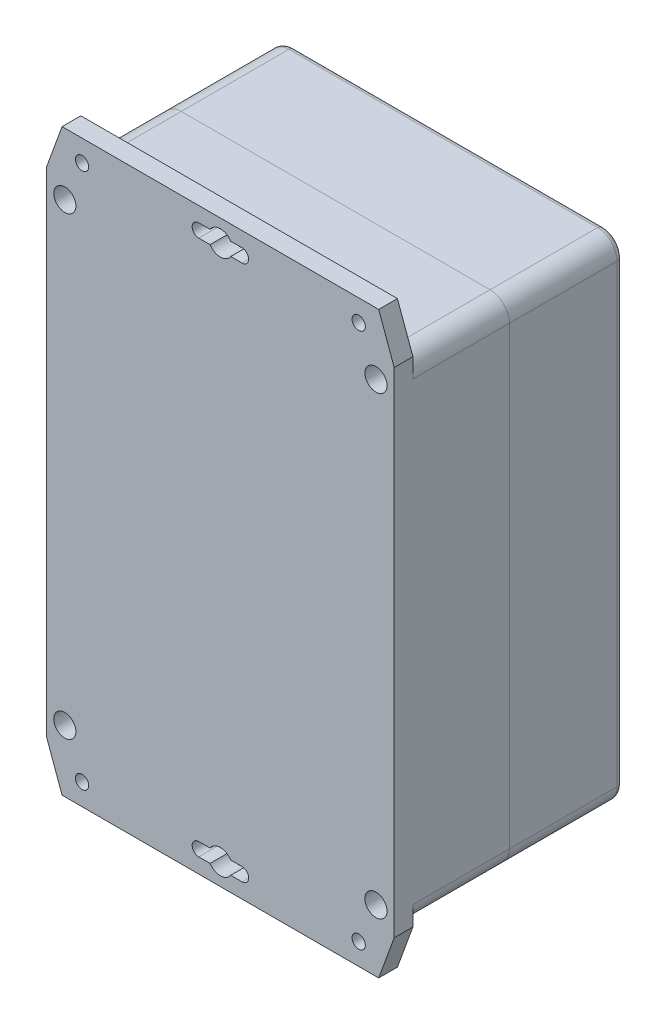
from build123d import *

# Parameters (mm, degrees)
SKETCH2_W               = 120.65
SKETCH2_H               = 200.9902
SKETCH2_R               = 2.2987
BOSS_EXTRUDE1_DEPTH     = 6.5024
CUT_EXTRUDE1_DEPTH      = 118.391021611
BOSS_EXTRUDE2_START     = -33.5026
SKETCH4_W               = 120.65
SKETCH4_H               = 171.45
BOSS_EXTRUDE2_DEPTH     = 33.5026
SKETCH5_R               = 3.8481
CUT_EXTRUDE2_DEPTH      = 24.003
SKETCH6_R               = 2.2225
CUT_EXTRUDE3_DEPTH      = 120.643281291
CUT_EXTRUDE4_DEPTH      = 37.0078
SKETCH9_R               = 3.0099
SKETCH9_R_2             = 1.2446
BOSS_EXTRUDE3_DEPTH     = 7.493
FILLET2_R               = 6.731
BOSS_EXTRUDE4_DEPTH     = 39.37
CUT_EXTRUDE5_START      = -3.2004
SKETCH12_R              = 3.8481
CUT_EXTRUDE5_DEPTH      = 3.2004
SHELL1_START            = -76.3778
SHELL1_DEPTH            = 36.3728
SHELL1_START_2          = -73.1774
SHELL1_2_DEPTH          = 33.1724
FILLET3_R               = 2.032
SKETCH13_R              = 3.5941
BOSS_EXTRUDE6_DEPTH     = 2.286
BOSS_EXTRUDE6_2_DEPTH   = 2.286
BOSS_EXTRUDE6_3_DEPTH   = 2.286
BOSS_EXTRUDE6_4_DEPTH   = 2.286
BOSS_EXTRUDE7_START     = 55.2196
SKETCH14_R              = 2.2225
BOSS_EXTRUDE7_DEPTH     = 55.2196
FILLET4_R               = 1.27
SKETCH15_W              = 1.524
SKETCH15_H              = 171.45
CUT_EXTRUDE_THIN1_DEPTH = 1.524


# Read off the part's stored shape, not the designer's step: Shell1
with BuildPart() as part:
    # Sketch2 → Boss-Extrude1 (new body)
    with BuildSketch(Plane.XY):
        Rectangle(SKETCH2_W, SKETCH2_H)
        with Locations((48.006, 93.0021)):
            Circle(SKETCH2_R, mode=Mode.SUBTRACT)
        with Locations((-48.006, 93.0021)):
            Circle(SKETCH2_R, mode=Mode.SUBTRACT)
        with Locations((-48.006, -93.0021)):
            Circle(SKETCH2_R, mode=Mode.SUBTRACT)
        with Locations((48.006, -93.0021)):
            Circle(SKETCH2_R, mode=Mode.SUBTRACT)
        with BuildLine():
            Line((-7.5057, -95.3008), (-3.580048681, -95.3008))
            ThreePointArc((-3.580048681, -95.3008), (0, -97.2566), (3.580048681, -95.3008))
            Line((3.580048681, -95.3008), (7.5057, -95.3008))
            ThreePointArc((7.5057, -95.3008), (9.8044, -93.0021), (7.5057, -90.7034))
            Line((7.5057, -90.7034), (3.580048681, -90.7034))
            ThreePointArc((3.580048681, -90.7034), (0, -88.7476), (-3.580048681, -90.7034))
            Line((-3.580048681, -90.7034), (-7.5057, -90.7034))
            ThreePointArc((-7.5057, -90.7034), (-9.8044, -93.0021), (-7.5057, -95.3008))
        make_face(mode=Mode.SUBTRACT)
        with BuildLine():
            Line((-3.580048681, 95.3008), (-7.5057, 95.3008))
            ThreePointArc((-7.5057, 95.3008), (-9.8044, 93.0021), (-7.5057, 90.7034))
            Line((-7.5057, 90.7034), (-3.580048681, 90.7034))
            ThreePointArc((-3.580048681, 90.7034), (0, 88.7476), (3.580048681, 90.7034))
            Line((3.580048681, 90.7034), (7.5057, 90.7034))
            ThreePointArc((7.5057, 90.7034), (9.8044, 93.0021), (7.5057, 95.3008))
            Line((7.5057, 95.3008), (3.580048681, 95.3008))
            ThreePointArc((3.580048681, 95.3008), (0, 97.2566), (-3.580048681, 95.3008))
        make_face(mode=Mode.SUBTRACT)
    extrude(amount=-BOSS_EXTRUDE1_DEPTH)

    # Sketch3 → Cut-Extrude1 (cut, through all)
    with BuildSketch(Plane(origin=(0, 0, -6.5024), x_dir=(-1, 0, 0), z_dir=(0, 0, -1))):
        Polygon((60.325, 85.725), (54.949123243, 100.4951), (60.325, 100.4951), align=None)
        Polygon((-60.325, 85.725), (-54.949123243, 100.4951), (-60.325, 100.4951), align=None)
        Polygon((60.325, -85.725), (54.949123243, -100.4951), (60.325, -100.4951), align=None)
        Polygon((-60.325, -85.725), (-54.949123243, -100.4951), (-60.325, -100.4951), align=None)
    extrude(amount=-CUT_EXTRUDE1_DEPTH, mode=Mode.SUBTRACT)

    # Sketch4 → Boss-Extrude2 (add)
    with BuildSketch(Plane.XY.offset(-6.5024).offset(BOSS_EXTRUDE2_START)):
        Rectangle(SKETCH4_W, SKETCH4_H)
    extrude(amount=BOSS_EXTRUDE2_DEPTH)

    # Sketch5 → Cut-Extrude2 (cut)
    with BuildSketch(Plane(origin=(0, 0, 0), x_dir=(-1, 0, 0), z_dir=(0, 0, -1))):
        with Locations((54.0004, 78.994)):
            Circle(SKETCH5_R)
        with Locations((-54.0004, 78.994)):
            Circle(SKETCH5_R)
        with Locations((-54.0004, -78.994)):
            Circle(SKETCH5_R)
        with Locations((54.0004, -78.994)):
            Circle(SKETCH5_R)
    extrude(amount=CUT_EXTRUDE2_DEPTH, mode=Mode.SUBTRACT)

    # Sketch6 → Cut-Extrude3 (cut, through all)
    with BuildSketch(Plane.XY.offset(-24.003)):
        with Locations((-54.0004, 78.994)):
            Circle(SKETCH6_R)
        with Locations((54.0004, 78.994)):
            Circle(SKETCH6_R)
        with Locations((54.0004, -78.994)):
            Circle(SKETCH6_R)
        with Locations((-54.0004, -78.994)):
            Circle(SKETCH6_R)
    extrude(amount=-CUT_EXTRUDE3_DEPTH, mode=Mode.SUBTRACT)

    # Sketch8 → Cut-Extrude4 (cut)
    with BuildSketch(Plane(origin=(0, 0, -40.005), x_dir=(-1, 0, 0), z_dir=(0, 0, -1))):
        with BuildLine():
            Line((33.5407, 83.185), (-33.5407, 83.185))
            ThreePointArc((-33.5407, 83.185), (-37.402210132, 81.585510132), (-39.0017, 77.724))
            ThreePointArc((-39.0017, 77.724), (-40.601189868, 73.862489868), (-44.4627, 72.263))
            Line((-44.4627, 72.263), (-54.0004, 72.263))
            ThreePointArc((-54.0004, 72.263), (-56.676516324, 71.154516324), (-57.785, 68.4784))
            Line((-57.785, 68.4784), (-57.785, -68.4784))
            ThreePointArc((-57.785, -68.4784), (-56.676516324, -71.154516324), (-54.0004, -72.263))
            Line((-54.0004, -72.263), (-44.4627, -72.263))
            ThreePointArc((-44.4627, -72.263), (-40.601189868, -73.862489868), (-39.0017, -77.724))
            ThreePointArc((-39.0017, -77.724), (-37.402210132, -81.585510132), (-33.5407, -83.185))
            Line((-33.5407, -83.185), (33.5407, -83.185))
            ThreePointArc((33.5407, -83.185), (37.402210132, -81.585510132), (39.0017, -77.724))
            ThreePointArc((39.0017, -77.724), (40.601189868, -73.862489868), (44.4627, -72.263))
            Line((44.4627, -72.263), (54.0004, -72.263))
            ThreePointArc((54.0004, -72.263), (56.676516324, -71.154516324), (57.785, -68.4784))
            Line((57.785, -68.4784), (57.785, 68.4784))
            ThreePointArc((57.785, 68.4784), (56.676516324, 71.154516324), (54.0004, 72.263))
            Line((54.0004, 72.263), (44.4627, 72.263))
            ThreePointArc((44.4627, 72.263), (40.601189868, 73.862489868), (39.0017, 77.724))
            ThreePointArc((39.0017, 77.724), (37.402210132, 81.585510132), (33.5407, 83.185))
        make_face()
    extrude(amount=-CUT_EXTRUDE4_DEPTH, mode=Mode.SUBTRACT)

    # Sketch9 → Boss-Extrude3 (add)
    # profile 1 of 6: a face of its own
    with BuildSketch(Plane(origin=(0, 0, 0), x_dir=(-1, 0, 0), z_dir=(0, 0, -1))):
        with Locations(Location((-45.5041, -66.0019, 0), (0, 0, 180))):
            Circle(SKETCH9_R)
        with Locations(Location((-45.5041, -66.0019, 0), (0, 0, 180))):
            Circle(SKETCH9_R_2, mode=Mode.SUBTRACT)
    # profile 2 of 6: a face of its own
    with BuildSketch(Plane(origin=(0, 0, 0), x_dir=(-1, 0, 0), z_dir=(0, 0, -1))):
        with Locations(Location((45.5041, -66.0019, 0), (0, 0, 180))):
            Circle(SKETCH9_R)
        with Locations(Location((45.5041, -66.0019, 0), (0, 0, 180))):
            Circle(SKETCH9_R_2, mode=Mode.SUBTRACT)
    # profile 3 of 6: a face of its own
    with BuildSketch(Plane(origin=(0, 0, 0), x_dir=(-1, 0, 0), z_dir=(0, 0, -1))):
        with Locations(Location((-45.5041, 52.0065, 0), (0, 0, 180))):
            Circle(SKETCH9_R)
        with Locations(Location((-45.5041, 52.0065, 0), (0, 0, 180))):
            Circle(SKETCH9_R_2, mode=Mode.SUBTRACT)
    # profile 4 of 6: a face of its own
    with BuildSketch(Plane(origin=(0, 0, 0), x_dir=(-1, 0, 0), z_dir=(0, 0, -1))):
        with Locations(Location((-45.5041, 66.0019, 0), (0, 0, 180))):
            Circle(SKETCH9_R)
        with Locations(Location((-45.5041, 66.0019, 0), (0, 0, 180))):
            Circle(SKETCH9_R_2, mode=Mode.SUBTRACT)
    # profile 5 of 6: a face of its own
    with BuildSketch(Plane(origin=(0, 0, 0), x_dir=(-1, 0, 0), z_dir=(0, 0, -1))):
        with Locations(Location((45.5041, 66.0019, 0), (0, 0, 180))):
            Circle(SKETCH9_R)
        with Locations(Location((45.5041, 66.0019, 0), (0, 0, 180))):
            Circle(SKETCH9_R_2, mode=Mode.SUBTRACT)
    # profile 6 of 6: a face of its own
    with BuildSketch(Plane(origin=(0, 0, 0), x_dir=(-1, 0, 0), z_dir=(0, 0, -1))):
        with Locations(Location((45.5041, 52.0065, 0), (0, 0, 180))):
            Circle(SKETCH9_R)
        with Locations(Location((45.5041, 52.0065, 0), (0, 0, 180))):
            Circle(SKETCH9_R_2, mode=Mode.SUBTRACT)
    extrude(amount=BOSS_EXTRUDE3_DEPTH)

    # Fillet2
    fillet2_edges = [part.edges().sort_by_distance(p)[0] for p in [
        (-60.325, -85.725, -23.2537),
        (-60.325, 85.725, -23.2537),
        (60.325, 85.725, -23.2537),
        (60.325, -85.725, -23.2537),
    ]]
    fillet(fillet2_edges, radius=FILLET2_R)



with BuildPart() as body_2:
    # Sketch11 → Boss-Extrude4 (new body)
    with BuildSketch(Plane(origin=(0, 0, -40.005), x_dir=(-1, 0, 0), z_dir=(0, 0, -1))):
        with BuildLine():
            Line((-60.325, 78.994), (-60.325, -78.994))
            ThreePointArc((-60.325, -78.994), (-58.353535744, -83.753535744), (-53.594, -85.725))
            Line((-53.594, -85.725), (53.594, -85.725))
            ThreePointArc((53.594, -85.725), (58.353535744, -83.753535744), (60.325, -78.994))
            Line((60.325, -78.994), (60.325, 78.994))
            ThreePointArc((60.325, 78.994), (58.353535744, 83.753535744), (53.594, 85.725))
            Line((53.594, 85.725), (-53.594, 85.725))
            ThreePointArc((-53.594, 85.725), (-58.353535744, 83.753535744), (-60.325, 78.994))
        make_face()
    extrude(amount=BOSS_EXTRUDE4_DEPTH)

    # Sketch12 → Cut-Extrude5 (cut)
    with BuildSketch(Plane(origin=(0, 0, -79.375), x_dir=(-1, 0, 0), z_dir=(0, 0, -1)).offset(CUT_EXTRUDE5_START)):
        with Locations((-54.0004, 78.994)):
            Circle(SKETCH12_R)
        with Locations((54.0004, 78.994)):
            Circle(SKETCH12_R)
        with Locations((54.0004, -78.994)):
            Circle(SKETCH12_R)
        with Locations((-54.0004, -78.994)):
            Circle(SKETCH12_R)
    extrude(amount=CUT_EXTRUDE5_DEPTH, mode=Mode.SUBTRACT)

    # Shell1 outline → Shell1 (cut)
    with BuildSketch(Plane.XY.offset(SHELL1_START)):
        with BuildLine():
            Line((-48.263077484, -82.7278), (48.263077484, -82.7278))
            ThreePointArc((48.263077484, -82.7278), (48.995200267, -74.324298969), (57.3278, -73.011814669))
            Line((57.3278, -73.011814669), (57.3278, 73.011814669))
            ThreePointArc((57.3278, 73.011814669), (48.995200267, 74.324298969), (48.263077484, 82.7278))
            Line((48.263077484, 82.7278), (-48.263077484, 82.7278))
            ThreePointArc((-48.263077484, 82.7278), (-48.995200267, 74.324298969), (-57.3278, 73.011814669))
            Line((-57.3278, 73.011814669), (-57.3278, -73.011814669))
            ThreePointArc((-57.3278, -73.011814669), (-48.995200267, -74.324298969), (-48.263077484, -82.7278))
        make_face()
    extrude(amount=SHELL1_DEPTH, mode=Mode.SUBTRACT)

    # Shell1 2 outline → Shell1 2 (cut)
    with BuildSketch(Plane.XY.offset(SHELL1_START_2)):
        with BuildLine():
            Line((48.263077484, -82.7278), (53.594, -82.7278))
            ThreePointArc((53.594, -82.7278), (56.2341953, -81.6341953), (57.3278, -78.994))
            Line((57.3278, -78.994), (57.3278, -73.011814669))
            ThreePointArc((57.3278, -73.011814669), (48.995200267, -74.324298969), (48.263077484, -82.7278))
        make_face()
        with BuildLine():
            Line((-53.594, -82.7278), (-48.263077484, -82.7278))
            ThreePointArc((-48.263077484, -82.7278), (-48.995200267, -74.324298969), (-57.3278, -73.011814669))
            Line((-57.3278, -73.011814669), (-57.3278, -78.994))
            ThreePointArc((-57.3278, -78.994), (-56.2341953, -81.6341953), (-53.594, -82.7278))
        make_face()
        with BuildLine():
            ThreePointArc((48.263077484, 82.7278), (48.995200267, 74.324298969), (57.3278, 73.011814669))
            Line((57.3278, 73.011814669), (57.3278, 78.994))
            ThreePointArc((57.3278, 78.994), (56.2341953, 81.6341953), (53.594, 82.7278))
            Line((53.594, 82.7278), (48.263077484, 82.7278))
        make_face()
        with BuildLine():
            Line((-57.3278, 78.994), (-57.3278, 73.011814669))
            ThreePointArc((-57.3278, 73.011814669), (-48.995200267, 74.324298969), (-48.263077484, 82.7278))
            Line((-48.263077484, 82.7278), (-53.594, 82.7278))
            ThreePointArc((-53.594, 82.7278), (-56.2341953, 81.6341953), (-57.3278, 78.994))
        make_face()
    extrude(amount=SHELL1_2_DEPTH, mode=Mode.SUBTRACT)

    # Fillet3
    fillet3_edges = [body_2.edges().sort_by_distance(p)[0] for p in [
        (58.353535744, -83.753535744, -79.375),
        (0, -85.725, -79.375),
        (-58.353535744, -83.753535744, -79.375),
        (-60.325, 0, -79.375),
        (-58.353535744, 83.753535744, -79.375),
        (0, 85.725, -79.375),
        (58.353535744, 83.753535744, -79.375),
        (60.325, 0, -79.375),
    ]]
    fillet(fillet3_edges, radius=FILLET3_R)


with BuildPart() as body_3:
    # Sketch13 → Boss-Extrude6 (new body)
    with BuildSketch(Plane(origin=(0, 0, -76.1746), x_dir=(-1, 0, 0), z_dir=(0, 0, -1))):
        with Locations((54.0004, 78.994)):
            Circle(SKETCH13_R)
    extrude(amount=BOSS_EXTRUDE6_DEPTH)


with BuildPart() as body_4:
    # Sketch13 → Boss-Extrude6 2 (new body)
    with BuildSketch(Plane(origin=(0, 0, -76.1746), x_dir=(-1, 0, 0), z_dir=(0, 0, -1))):
        with Locations((-54.0004, 78.994)):
            Circle(SKETCH13_R)
    extrude(amount=BOSS_EXTRUDE6_2_DEPTH)


with BuildPart() as body_5:
    # Sketch13 → Boss-Extrude6 3 (new body)
    with BuildSketch(Plane(origin=(0, 0, -76.1746), x_dir=(-1, 0, 0), z_dir=(0, 0, -1))):
        with Locations((54.0004, -78.994)):
            Circle(SKETCH13_R)
    extrude(amount=BOSS_EXTRUDE6_3_DEPTH)


with BuildPart() as body_6:
    # Sketch13 → Boss-Extrude6 4 (new body)
    with BuildSketch(Plane(origin=(0, 0, -76.1746), x_dir=(-1, 0, 0), z_dir=(0, 0, -1))):
        with Locations((-54.0004, -78.994)):
            Circle(SKETCH13_R)
    extrude(amount=BOSS_EXTRUDE6_4_DEPTH)


with BuildPart() as part_1:
    add(part.part)

    add(body_3.part)  # Boss-Extrude7 merges body 3

    add(body_5.part)  # Boss-Extrude7 merges body 5

    add(body_6.part)  # Boss-Extrude7 merges body 6

    add(body_4.part)  # Boss-Extrude7 merges body 4
    # Sketch14 → Boss-Extrude7 (add)
    with BuildSketch(Plane.XY.offset(-76.1746).offset(BOSS_EXTRUDE7_START)):
        with Locations(Location((-54.0004, 78.994, 0), (0, 0, 180))):
            Circle(SKETCH14_R)
        with Locations(Location((-54.0004, -78.994, 0), (0, 0, 180))):
            Circle(SKETCH14_R)
        with Locations(Location((54.0004, -78.994, 0), (0, 0, 180))):
            Circle(SKETCH14_R)
        with Locations(Location((54.0004, 78.994, 0), (0, 0, 180))):
            Circle(SKETCH14_R)
    extrude(amount=-BOSS_EXTRUDE7_DEPTH)

    # Fillet4
    fillet4_edges = [part_1.edges().sort_by_distance(p)[0] for p in [
        (-50.4063, 78.994, -78.4606),
        (-50.4063, -78.994, -78.4606),
        (57.5945, -78.994, -78.4606),
        (57.5945, 78.994, -78.4606),
    ]]
    fillet(fillet4_edges, radius=FILLET4_R)

    # Sketch15 → Cut-Extrude-Thin1 (cut)
    with BuildSketch(Plane(origin=(0, 0, -78.4606), x_dir=(-1, 0, 0), z_dir=(0, 0, -1))):
        with Locations((-54.0004, 0)):
            Rectangle(SKETCH15_W, SKETCH15_H)
    cut_extrude_thin1 = extrude(amount=-CUT_EXTRUDE_THIN1_DEPTH, mode=Mode.SUBTRACT)

    # Mirror1: Cut-Extrude-Thin1 across plane
    add(cut_extrude_thin1.mirror(Plane(origin=(0, 0, 0), x_dir=(0, 0, 1), z_dir=(1, 0, 0))), mode=Mode.SUBTRACT)


with BuildPart() as body_3_2:
    # Sweep1: sweep along a path in Sketch16
    with BuildLine(Plane(origin=(0, 0, -40.005), x_dir=(-1, 0, 0), z_dir=(0, 0, -1))) as sweep1_path:
        Line((33.5407, 83.185), (-33.5407, 83.185))
        ThreePointArc((-33.5407, 83.185), (-37.402210132, 81.585510132), (-39.0017, 77.724))
        ThreePointArc((-39.0017, 77.724), (-40.601189868, 73.862489868), (-44.4627, 72.263))
        Line((-44.4627, 72.263), (-54.0004, 72.263))
        ThreePointArc((-54.0004, 72.263), (-56.676516324, 71.154516324), (-57.785, 68.4784))
        Line((-57.785, 68.4784), (-57.785, -68.4784))
        ThreePointArc((-57.785, -68.4784), (-56.676516324, -71.154516324), (-54.0004, -72.263))
        Line((-54.0004, -72.263), (-44.4627, -72.263))
        ThreePointArc((-44.4627, -72.263), (-40.601189868, -73.862489868), (-39.0017, -77.724))
        ThreePointArc((-39.0017, -77.724), (-37.402210132, -81.585510132), (-33.5407, -83.185))
        Line((-33.5407, -83.185), (33.5407, -83.185))
        ThreePointArc((33.5407, -83.185), (37.402210132, -81.585510132), (39.0017, -77.724))
        ThreePointArc((39.0017, -77.724), (40.601189868, -73.862489868), (44.4627, -72.263))
        Line((44.4627, -72.263), (54.0004, -72.263))
        ThreePointArc((54.0004, -72.263), (56.676516324, -71.154516324), (57.785, -68.4784))
        Line((57.785, -68.4784), (57.785, 68.4784))
        ThreePointArc((57.785, 68.4784), (56.676516324, 71.154516324), (54.0004, 72.263))
        Line((54.0004, 72.263), (44.4627, 72.263))
        ThreePointArc((44.4627, 72.263), (40.601189868, 73.862489868), (39.0017, 77.724))
        ThreePointArc((39.0017, 77.724), (37.402210132, 81.585510132), (33.5407, 83.185))
    # Sketch17 → Sweep1 (sweep)
    with BuildSketch(Plane(origin=(0, 68.4784, 0), x_dir=(-1, 0, 0), z_dir=(0, 1, 0))):
        with BuildLine():
            Line((-59.055, -40.005), (-57.785, -40.005))
            ThreePointArc((-57.785, -40.005), (-58.42, -40.64), (-59.055, -40.005))
        make_face()
    sweep(path=sweep1_path.line)


solid = Compound([body_2.part, part_1.part, body_3_2.part])
